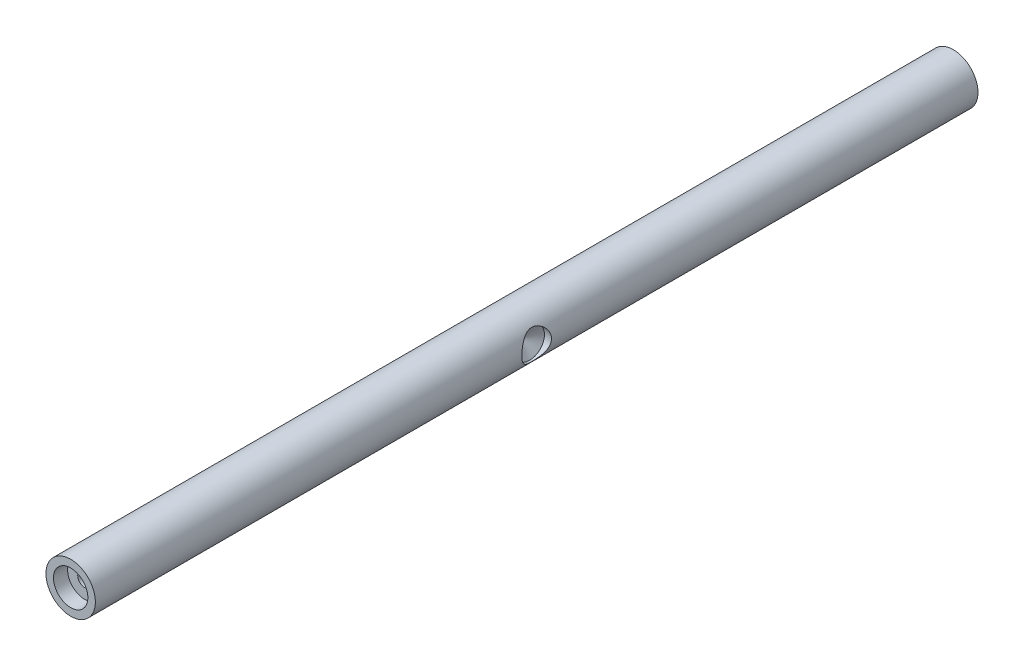
from build123d import *

# Parameters (mm, degrees)
SCHIZZO1_R                   = 7
ESTRUSIONE_ESTRUSIONE1_DEPTH = 125
TAGLIO_ESTRUSIONE1_REACH     = 252.196
SCHIZZO2_R                   = 2
SCHIZZO5_R                   = 4.87
TAGLIO_ESTRUSIONE2_DEPTH     = 4
FORO_PER_VITE_M8_1_D         = 8.4
FORO_PER_VITE_M8_1_DEPTH     = 2
FORO_PER_VITE_M8_1_TIP       = 2.5236146


with BuildPart() as part:
    # Schizzo1 → Estrusione-Estrusione1 (new, symmetric)
    with BuildSketch(Plane.XY):
        Circle(SCHIZZO1_R)
    extrude(amount=ESTRUSIONE_ESTRUSIONE1_DEPTH, both=True)

    # Schizzo2 → Taglio-Estrusione1 (cut, up to next)
    with BuildSketch(Plane.XY.offset(125), mode=Mode.PRIVATE) as taglio_estrusione1_sk1:
        Circle(SCHIZZO2_R)
    taglio_estrusione1_tool1 = extrude(taglio_estrusione1_sk1.sketch, amount=-TAGLIO_ESTRUSIONE1_REACH, mode=Mode.PRIVATE) & part.part
    add(taglio_estrusione1_tool1.solids().sort_by_distance((0, 0, 125))[0], mode=Mode.SUBTRACT)

    # Schizzo5 → Taglio-Estrusione2 (cut)
    with BuildSketch(Plane.XY.offset(125)):
        Circle(SCHIZZO5_R)
    extrude(amount=-TAGLIO_ESTRUSIONE2_DEPTH, mode=Mode.SUBTRACT)

    # Foro per Vite M8-1
    with Locations(Plane(origin=(7, 0, 0), x_dir=(0, 0, -1), z_dir=(1, 0, 0))):
        with Locations((0, 0)):
            Hole(FORO_PER_VITE_M8_1_D / 2, depth=FORO_PER_VITE_M8_1_DEPTH)
            with Locations((0, 0, -(FORO_PER_VITE_M8_1_DEPTH + FORO_PER_VITE_M8_1_TIP / 2))):  # 118° drill point
                Cone(0, FORO_PER_VITE_M8_1_D / 2, FORO_PER_VITE_M8_1_TIP, mode=Mode.SUBTRACT)


solid = part.part
